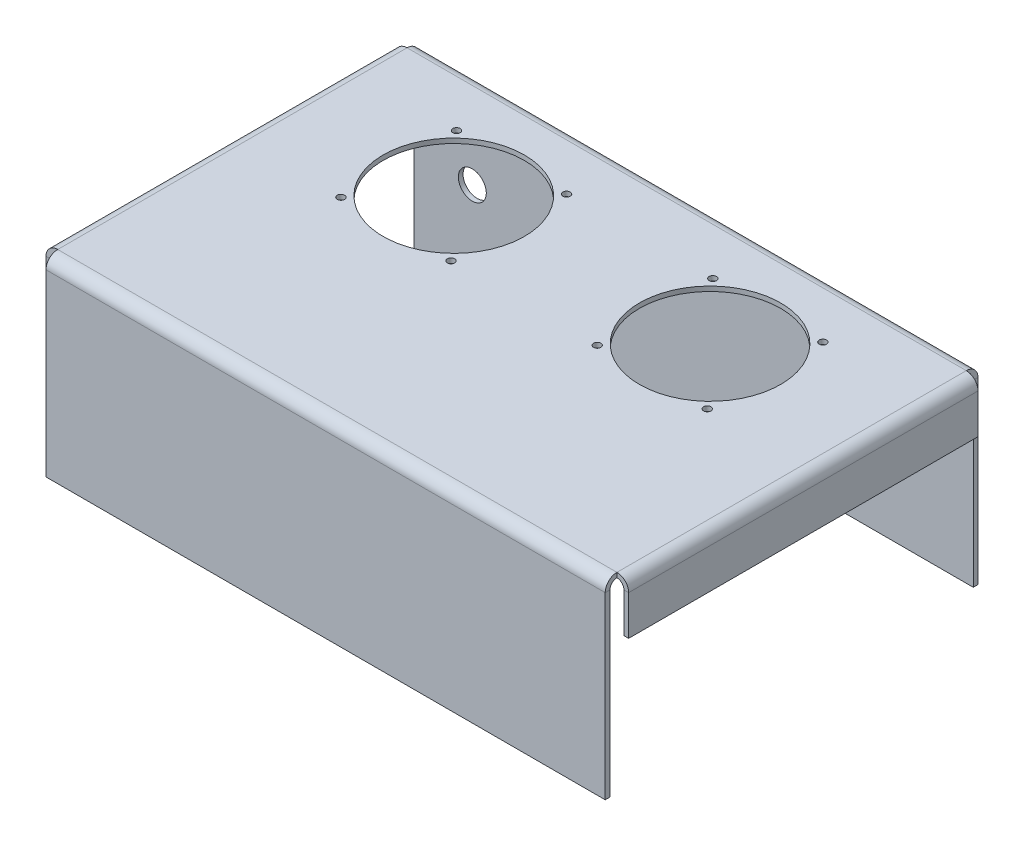
from build123d import *

# Parameters (mm, degrees)
SKETCH1_W                      = 152.4
SKETCH1_H                      = 101.6
BASE_FLANGE1_DEPTH             = 1.29032
EDGE_FLANGE1_STRIP_W           = 8.97128
EDGE_FLANGE1_STRIP_H           = 1.29032
EDGE_FLANGE1_STRIP_CUT_DEPTH   = 152.4
EDGE_FLANGE1_STRIP_2_W         = 8.97128
EDGE_FLANGE1_STRIP_2_H         = 1.29032
EDGE_FLANGE1_STRIP_CUT_2_DEPTH = 152.4
EDGE_FLANGE1_DEPTH             = 152.4
EDGE_FLANGE1_BEND_DEPTH        = 152.4
EDGE_FLANGE2_DEPTH             = 95.20936
EDGE_FLANGE2_BEND_DEPTH        = 95.20936
SKETCH22_R                     = 19.249999981
SKETCH22_R_2                   = 1
CUT_EXTRUDE1_DEPTH             = 2.54
CUT_EXTRUDE2_REACH             = 141.067
SKETCH23_R                     = 3.81


# Sheet-metal steps are written as plain solids
with BuildPart() as part:
    # Sketch1 → Base-Flange1 (new body)
    with BuildSketch(Plane(origin=(0, 0, 0), x_dir=(1, 0, 0), z_dir=(0, 1, 0))):
        Rectangle(SKETCH1_W, SKETCH1_H)
    extrude(amount=-BASE_FLANGE1_DEPTH)

    # Edge-Flange1 strip (across the edge) → Edge-Flange1 strip cut (cut)
    with BuildSketch(Plane(origin=(76.2, -1.29032, 50.8), x_dir=(0, 0, -1), z_dir=(-1, 0, 0))):
        with Locations((-1.29032, -0.64516)):
            Rectangle(EDGE_FLANGE1_STRIP_W, EDGE_FLANGE1_STRIP_H)
    extrude(amount=EDGE_FLANGE1_STRIP_CUT_DEPTH, mode=Mode.SUBTRACT)

    # Edge-Flange1 strip 2 (across the edge) → Edge-Flange1 strip cut 2 (cut)
    with BuildSketch(Plane(origin=(-76.2, -1.29032, -50.8), x_dir=(0, 0, 1), z_dir=(1, 0, 0))):
        with Locations((-1.29032, -0.64516)):
            Rectangle(EDGE_FLANGE1_STRIP_2_W, EDGE_FLANGE1_STRIP_2_H)
    extrude(amount=EDGE_FLANGE1_STRIP_CUT_2_DEPTH, mode=Mode.SUBTRACT)

    # Edge-Flange1 section (across the edge) → Edge-Flange1 (add)
    with BuildSketch(Plane(origin=(76.2, -1.29032, 50.8), x_dir=(0, 0, -1), z_dir=(-1, 0, 0))):
        with BuildLine():
            Line((0, 1.905), (0, 50.8))
            Line((0, 50.8), (1.29032, 50.8))
            Line((1.29032, 50.8), (1.29032, 1.905))
            ThreePointArc((1.29032, 1.905), (1.848281582, 0.557961582), (3.19532, 0))
            Line((3.19532, 0), (3.19532, -1.29032))
            ThreePointArc((3.19532, -1.29032), (0.93588756, -0.35443244), (0, 1.905))
        make_face()
    extrude(amount=EDGE_FLANGE1_DEPTH)

    # Edge-Flange1 section 2 (across the edge) → Edge-Flange1 bend (add)
    with BuildSketch(Plane(origin=(-76.2, -1.29032, -50.8), x_dir=(0, 0, 1), z_dir=(1, 0, 0))):
        with BuildLine():
            Line((0, 1.905), (0, 50.8))
            Line((0, 50.8), (1.29032, 50.8))
            Line((1.29032, 50.8), (1.29032, 1.905))
            ThreePointArc((1.29032, 1.905), (1.848281582, 0.557961582), (3.19532, 0))
            Line((3.19532, 0), (3.19532, -1.29032))
            ThreePointArc((3.19532, -1.29032), (0.93588756, -0.35443244), (0, 1.905))
        make_face()
    extrude(amount=EDGE_FLANGE1_BEND_DEPTH)

    # Edge-Flange2 section (across the edge) → Edge-Flange2 (add)
    with BuildSketch(Plane(origin=(-78.105, -1.29032, 47.60468), x_dir=(1, 0, 0), z_dir=(0, 0, -1))):
        with BuildLine():
            Line((-1.29032, 1.905), (-1.29032, 12.7))
            Line((-1.29032, 12.7), (0, 12.7))
            Line((0, 12.7), (0, 1.905))
            ThreePointArc((0, 1.905), (0.557961582, 0.557961582), (1.905, 0))
            Line((1.905, 0), (1.905, -1.29032))
            ThreePointArc((1.905, -1.29032), (-0.35443244, -0.35443244), (-1.29032, 1.905))
        make_face()
    extrude(amount=EDGE_FLANGE2_DEPTH)

    # Edge-Flange2 section 2 (across the edge) → Edge-Flange2 bend (add)
    with BuildSketch(Plane(origin=(78.105, -1.29032, -47.60468), x_dir=(-1, 0, 0), z_dir=(0, 0, 1))):
        with BuildLine():
            Line((-1.29032, 1.905), (-1.29032, 12.7))
            Line((-1.29032, 12.7), (0, 12.7))
            Line((0, 12.7), (0, 1.905))
            ThreePointArc((0, 1.905), (0.557961582, 0.557961582), (1.905, 0))
            Line((1.905, 0), (1.905, -1.29032))
            ThreePointArc((1.905, -1.29032), (-0.35443244, -0.35443244), (-1.29032, 1.905))
        make_face()
    extrude(amount=EDGE_FLANGE2_BEND_DEPTH)

    # Sketch22 → Cut-Extrude1 (cut)
    with BuildSketch(Plane(origin=(0, 0, 0), x_dir=(1, 0, 0), z_dir=(0, 1, 0))):
        with Locations(Location((34.925, 19.05, 0), (0, 0, 270))):
            Circle(SKETCH22_R)
        with Locations(Location((19.925, 34.8, 0), (0, 0, 270))):
            Circle(SKETCH22_R_2)
        with Locations(Location((49.925, 34.8, 0), (0, 0, 270))):
            Circle(SKETCH22_R_2)
        with Locations(Location((49.925, 3.3, 0), (0, 0, 270))):
            Circle(SKETCH22_R_2)
        with Locations(Location((19.925, 3.3, 0), (0, 0, 270))):
            Circle(SKETCH22_R_2)
        with Locations(Location((-19.925, 3.3, 0), (0, 0, 90))):
            Circle(SKETCH22_R_2)
        with Locations(Location((-49.925, 3.3, 0), (0, 0, 90))):
            Circle(SKETCH22_R_2)
        with Locations(Location((-49.925, 34.8, 0), (0, 0, 90))):
            Circle(SKETCH22_R_2)
        with Locations(Location((-19.925, 34.8, 0), (0, 0, 90))):
            Circle(SKETCH22_R_2)
        with Locations(Location((-34.925, 19.05, 0), (0, 0, 90))):
            Circle(SKETCH22_R)
    extrude(amount=-CUT_EXTRUDE1_DEPTH, mode=Mode.SUBTRACT)

    # Sketch23 → Cut-Extrude2 (cut, up to next)
    with BuildSketch(Plane(origin=(0, 0, -50.8), x_dir=(-1, 0, 0), z_dir=(0, 0, -1)), mode=Mode.PRIVATE) as cut_extrude2_sk1:
        with Locations(Location((60.325, -25.4, 0), (0, 0, 90))):
            Circle(SKETCH23_R)
    cut_extrude2_tool1 = extrude(cut_extrude2_sk1.sketch, amount=-CUT_EXTRUDE2_REACH, mode=Mode.PRIVATE) & part.part
    # Sketch23 → Cut-Extrude2 (cut, up to next)
    with BuildSketch(Plane(origin=(0, 0, -50.8), x_dir=(-1, 0, 0), z_dir=(0, 0, -1)), mode=Mode.PRIVATE) as cut_extrude2_sk2:
        with Locations(Location((-60.325, -25.4, 0), (0, 0, 90))):
            Circle(SKETCH23_R)
    cut_extrude2_tool2 = extrude(cut_extrude2_sk2.sketch, amount=-CUT_EXTRUDE2_REACH, mode=Mode.PRIVATE) & part.part
    add(cut_extrude2_tool1.solids().sort_by_distance((-60.325, -25.4, -50.8))[0], mode=Mode.SUBTRACT)
    add(cut_extrude2_tool2.solids().sort_by_distance((60.325, -25.4, -50.8))[0], mode=Mode.SUBTRACT)


solid = part.part
